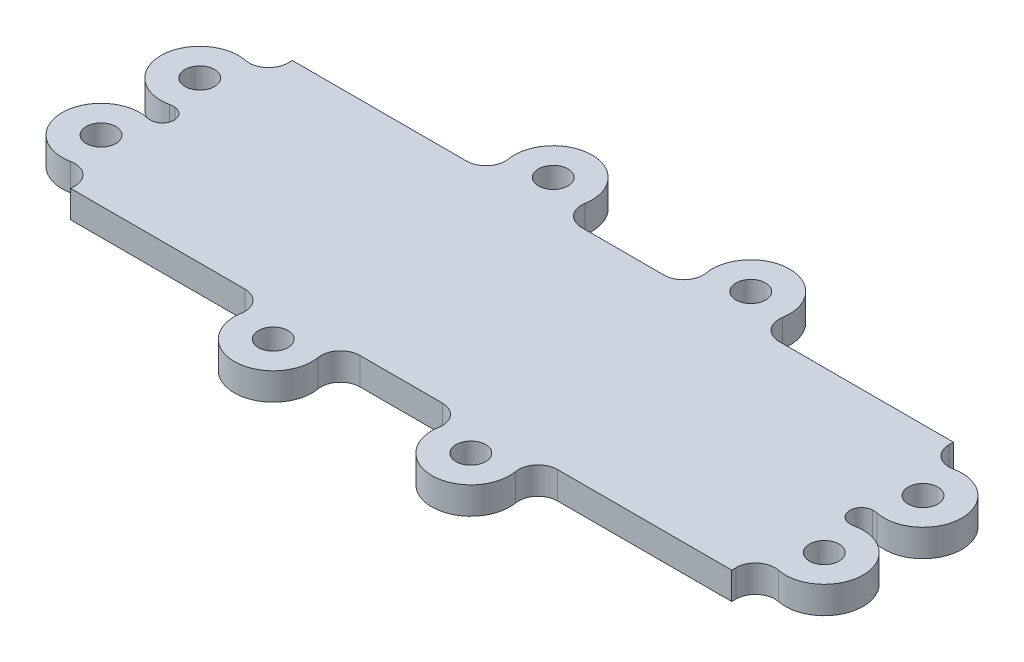
from build123d import *

# Parameters (mm, degrees)
SKETCH1_W           = 170
SKETCH1_H           = 57
BOSS_EXTRUDE1_DEPTH = 7
SKETCH2_R           = 10
SKETCH2_R_2         = 3.81
BOSS_EXTRUDE2_DEPTH = 7
FILLET1_R           = 5
FILLET2_R           = 3


with BuildPart() as part:
    # Sketch1 → Boss-Extrude1 (new body)
    with BuildSketch(Plane(origin=(0, 0, 0), x_dir=(1, 0, 0), z_dir=(0, 1, 0))):
        Rectangle(SKETCH1_W, SKETCH1_H)
    extrude(amount=BOSS_EXTRUDE1_DEPTH)

    # Sketch2 → Boss-Extrude2 (add)
    # profile 1 of 8: a face of its own
    with BuildSketch(Plane(origin=(0, 7, 0), x_dir=(1, 0, 0), z_dir=(0, 1, 0))):
        with Locations((-25.4, 36)):
            Circle(SKETCH2_R)
        with Locations(Location((-25.4, 36, 0), (0, 0, 270))):
            Circle(SKETCH2_R_2, mode=Mode.SUBTRACT)
    # profile 2 of 8: a face of its own
    with BuildSketch(Plane(origin=(0, 7, 0), x_dir=(1, 0, 0), z_dir=(0, 1, 0))):
        with Locations((25.4, 36)):
            Circle(SKETCH2_R)
        with Locations(Location((25.4, 36, 0), (0, 0, 270))):
            Circle(SKETCH2_R_2, mode=Mode.SUBTRACT)
    # profile 3 of 8: a face of its own
    with BuildSketch(Plane(origin=(0, 7, 0), x_dir=(1, 0, 0), z_dir=(0, 1, 0))):
        with Locations((-93, 12.7)):
            Circle(SKETCH2_R)
        with Locations(Location((-93, 12.7, 0), (0, 0, 270))):
            Circle(SKETCH2_R_2, mode=Mode.SUBTRACT)
    # profile 4 of 8: a face of its own
    with BuildSketch(Plane(origin=(0, 7, 0), x_dir=(1, 0, 0), z_dir=(0, 1, 0))):
        with Locations((-93, -12.7)):
            Circle(SKETCH2_R)
        with Locations(Location((-93, -12.7, 0), (0, 0, 270))):
            Circle(SKETCH2_R_2, mode=Mode.SUBTRACT)
    # profile 5 of 8: a face of its own
    with BuildSketch(Plane(origin=(0, 7, 0), x_dir=(1, 0, 0), z_dir=(0, 1, 0))):
        with Locations((93, -12.7)):
            Circle(SKETCH2_R)
        with Locations(Location((93, -12.7, 0), (0, 0, 270))):
            Circle(SKETCH2_R_2, mode=Mode.SUBTRACT)
    # profile 6 of 8: a face of its own
    with BuildSketch(Plane(origin=(0, 7, 0), x_dir=(1, 0, 0), z_dir=(0, 1, 0))):
        with Locations((93, 12.7)):
            Circle(SKETCH2_R)
        with Locations(Location((93, 12.7, 0), (0, 0, 270))):
            Circle(SKETCH2_R_2, mode=Mode.SUBTRACT)
    # profile 7 of 8: a face of its own
    with BuildSketch(Plane(origin=(0, 7, 0), x_dir=(1, 0, 0), z_dir=(0, 1, 0))):
        with Locations((25.4, -36)):
            Circle(SKETCH2_R)
        with Locations(Location((25.4, -36, 0), (0, 0, 270))):
            Circle(SKETCH2_R_2, mode=Mode.SUBTRACT)
    # profile 8 of 8: a face of its own
    with BuildSketch(Plane(origin=(0, 7, 0), x_dir=(1, 0, 0), z_dir=(0, 1, 0))):
        with Locations((-25.4, -36)):
            Circle(SKETCH2_R)
        with Locations(Location((-25.4, -36, 0), (0, 0, 270))):
            Circle(SKETCH2_R_2, mode=Mode.SUBTRACT)
    extrude(amount=-BOSS_EXTRUDE2_DEPTH)

    # Fillet1
    # the kernel refuses this fillet: 5 mm, written as the material it adds along each edge
    with BuildSketch(Plane(origin=(-18.785621722, 0, -28.5), x_dir=(1, 0, 0), z_dir=(0, 1, 0)), Plane(origin=(32.014378278, 0, -28.5), x_dir=(1, 0, 0), z_dir=(0, 1, 0)), Plane(origin=(18.785621722, 0, 28.5), x_dir=(-1, 0, 0), z_dir=(0, 1, 0)), Plane(origin=(-32.014378278, 0, 28.5), x_dir=(-1, 0, 0), z_dir=(0, 1, 0))) as fillet1_piece_1:
        with BuildLine():
            CenterArc((8.17582118, 5), FILLET1_R, 170.405931773, 99.594068227)
            ThreePointArc((3.245754694, 5.833333333), (2.124003991, 2.63783224), (0, 0))
            Line((0, 0), (8.17582118, 0))
        make_face()
    extrude(amount=7)
    with BuildSketch(Plane(origin=(-32.014378278, 0, -28.5), x_dir=(-1, 0, 0), z_dir=(0, 1, 0))) as fillet1_piece_2:
        with BuildLine():
            CenterArc((8.17582118, -5), FILLET1_R, 90, 99.594068227)
            ThreePointArc((3.245754694, -5.833333333), (2.124003991, -2.63783224), (0, 0))
            Line((0, 0), (8.17582118, 0))
        make_face()
    extrude(amount=7)
    with BuildSketch(Plane(origin=(18.785621722, 0, -28.5), x_dir=(-0.4862167760179408, 0, -0.8738382268582209), z_dir=(0, 1, 0)), Plane(origin=(32.014378278, 0, 28.5), x_dir=(0.4862167760179433, 0, 0.8738382268582195), z_dir=(0, 1, 0)), Plane(origin=(-18.785621722, 0, 28.5), x_dir=(0.4862167760179409, 0, 0.8738382268582208), z_dir=(0, 1, 0))) as fillet1_piece_3:
        with BuildLine():
            CenterArc((8.34441255, 4.713261203), FILLET1_R, 150.907776941, 99.594068227)
            Line((3.975221415, 7.144345083), (0, 0))
            ThreePointArc((0, 0), (3.33776502, 0.573477594), (6.67553004, 0))
        make_face()
    extrude(amount=7)
    with BuildSketch(Plane(origin=(-85, 0, -18.7), x_dir=(0, 0, -1), z_dir=(0, 1, 0)), Plane(origin=(-85, 0, 6.7), x_dir=(0, 0, -1), z_dir=(0, 1, 0)), Plane(origin=(85, 0, 18.7), x_dir=(0, 0, 1), z_dir=(0, 1, 0)), Plane(origin=(85, 0, -6.7), x_dir=(0, 0, 1), z_dir=(0, 1, 0))) as fillet1_piece_4:
        with BuildLine():
            CenterArc((8.696938457, 5), FILLET1_R, 168.463040967, 101.536959033)
            ThreePointArc((3.797958971, 6), (2.449489743, 2.651530772), (0, 0))
            Line((0, 0), (8.696938457, 0))
        make_face()
    extrude(amount=7)
    with BuildSketch(Plane(origin=(-85, 0, -6.7), x_dir=(-0.8449489742783158, 0, 0.5348469228349566), z_dir=(0, 1, 0)), Plane(origin=(-85, 0, 18.7), x_dir=(-0.844948974278316, 0, 0.5348469228349564), z_dir=(0, 1, 0)), Plane(origin=(85, 0, 6.7), x_dir=(0.8449489742783187, 0, -0.5348469228349522), z_dir=(0, 1, 0)), Plane(origin=(85, 0, -18.7), x_dir=(0.8449489742783186, 0, -0.5348469228349523), z_dir=(0, 1, 0))) as fillet1_piece_5:
        with BuildLine():
            CenterArc((8.876275643, 4.674234614), FILLET1_R, 147.666469307, 101.536959033)
            Line((4.651530772, 7.348469228), (0, 0))
            ThreePointArc((0, 0), (3.550510257, 0.651530772), (7.101020514, 0))
        make_face()
    extrude(amount=7)

    # Fillet2
    # the kernel refuses this fillet: 3 mm, written as the material it adds along each edge
    with BuildSketch(Plane(origin=(-85.416089355, 7, 0), x_dir=(-0.8209960620456767, 0, 0.5709338544047737), z_dir=(0, -1, 0)), Plane(origin=(85.416089355, 7, 0), x_dir=(0.8209960620456767, 0, -0.5709338544047737), z_dir=(0, -1, 0))) as fillet2_piece_1:
        with BuildLine():
            CenterArc((3.672553945, 2.553953029), FILLET2_R, 127.986021581, 173.658700766)
            ThreePointArc((1.826146326, 4.918435827), (0.216147897, 2.717976503), (0, 0))
            ThreePointArc((0, 0), (2.623252818, -0.743411618), (5.246505636, 0))
        make_face()
    extrude(amount=7)


solid = part.part
